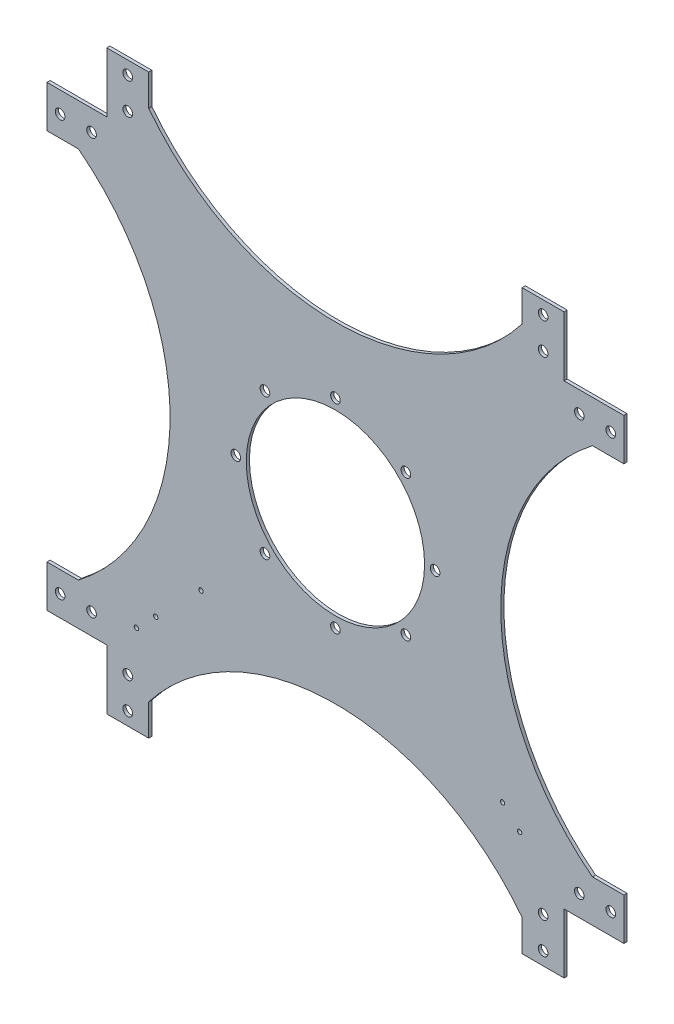
from build123d import *

# Parameters (mm, degrees)
SKETCH1_R          = 85
BASE_FLANGE1_DEPTH = 3
SKETCH2_R          = 4.6
EXTRUDE1_DEPTH     = 3
SKETCH3_R          = 4.6
EXTRUDE2_DEPTH     = 3
CIRPATTERN1_COUNT  = 8
SKETCH4_R          = 2.1
CUT_EXTRUDE1_DEPTH = 10


# Sheet-metal steps are written as plain solids
with BuildPart() as part:
    # Sketch1 → Base-Flange1 (new body)
    with BuildSketch(Plane.XY):
        with BuildLine():
            Line((218, 218), (218, 275))
            Line((218, 275), (178, 275))
            Line((178, 275), (178, 245))
            ThreePointArc((178, 245), (0, 157.626305625), (-178, 245))
            Line((-178, 245), (-178, 275))
            Line((-178, 275), (-218, 275))
            Line((-218, 275), (-218, 218))
            Line((-218, 218), (-275, 218))
            Line((-275, 218), (-275, 178))
            Line((-275, 178), (-245, 178))
            ThreePointArc((-245, 178), (-157.626305625, 0), (-245, -178))
            Line((-245, -178), (-275, -178))
            Line((-275, -178), (-275, -218))
            Line((-275, -218), (-218, -218))
            Line((-218, -218), (-218, -275))
            Line((-218, -275), (-178, -275))
            Line((-178, -275), (-178, -245))
            ThreePointArc((-178, -245), (0, -157.626305625), (178, -245))
            Line((178, -245), (178, -275))
            Line((178, -275), (218, -275))
            Line((218, -275), (218, -218))
            Line((218, -218), (275, -218))
            Line((275, -218), (275, -178))
            Line((275, -178), (245, -178))
            ThreePointArc((245, -178), (157.626305625, 0), (245, 178))
            Line((245, 178), (275, 178))
            Line((275, 178), (275, 218))
            Line((275, 218), (218, 218))
        make_face()
        Circle(SKETCH1_R, mode=Mode.SUBTRACT)
    extrude(amount=BASE_FLANGE1_DEPTH)

    # Sketch2 → Extrude1 (cut)
    with BuildSketch(Plane.XY.offset(3)):
        with Locations((198, 262.5)):
            Circle(SKETCH2_R)
        with Locations((198, 232.5)):
            Circle(SKETCH2_R)
        with Locations((232.5, 198)):
            Circle(SKETCH2_R)
        with Locations((262.5, 198)):
            Circle(SKETCH2_R)
        with Locations(Location((262.5, -198, 0), (0, 0, 180))):
            Circle(SKETCH2_R)
        with Locations(Location((232.5, -198, 0), (0, 0, 180))):
            Circle(SKETCH2_R)
        with Locations(Location((198, -232.5, 0), (0, 0, 180))):
            Circle(SKETCH2_R)
        with Locations(Location((198, -262.5, 0), (0, 0, 180))):
            Circle(SKETCH2_R)
        with Locations((-198, -262.5)):
            Circle(SKETCH2_R)
        with Locations((-198, -232.5)):
            Circle(SKETCH2_R)
        with Locations((-232.5, -198)):
            Circle(SKETCH2_R)
        with Locations((-262.5, -198)):
            Circle(SKETCH2_R)
        with Locations(Location((-262.5, 198, 0), (0, 0, 180))):
            Circle(SKETCH2_R)
        with Locations(Location((-232.5, 198, 0), (0, 0, 180))):
            Circle(SKETCH2_R)
        with Locations(Location((-198, 232.5, 0), (0, 0, 180))):
            Circle(SKETCH2_R)
        with Locations(Location((-198, 262.5, 0), (0, 0, 180))):
            Circle(SKETCH2_R)
    extrude(amount=-EXTRUDE1_DEPTH, mode=Mode.SUBTRACT)

    # Sketch3 → Extrude2 (cut)
    with BuildSketch(Plane.XY.offset(3)):
        with Locations((0, 95)):
            Circle(SKETCH3_R)
    extrude2 = extrude(amount=-EXTRUDE2_DEPTH, mode=Mode.SUBTRACT)

    # CirPattern1: Extrude2 ×8 about axis
    cirpattern1_axis = Axis((0, 0, 0), (0, 0, 1))
    for i in range(1, CIRPATTERN1_COUNT):
        add(extrude2.rotate(cirpattern1_axis, i * 360 / CIRPATTERN1_COUNT), mode=Mode.SUBTRACT)

    # Sketch4 → Cut-Extrude1 (cut)
    with BuildSketch(Plane.XY.offset(3)):
        with Locations((-189.715728753, -189.715728753)):
            Circle(SKETCH4_R)
        with Locations((-171.330952442, -171.330952442)):
            Circle(SKETCH4_R)
        with Locations((-128.197438789, -128.197438789)):
            Circle(SKETCH4_R)
        with Locations((175.573593129, -175.573593129)):
            Circle(SKETCH4_R)
        with Locations((159.310137162, -159.310137162)):
            Circle(SKETCH4_R)
    extrude(amount=-CUT_EXTRUDE1_DEPTH, mode=Mode.SUBTRACT)


solid = part.part
